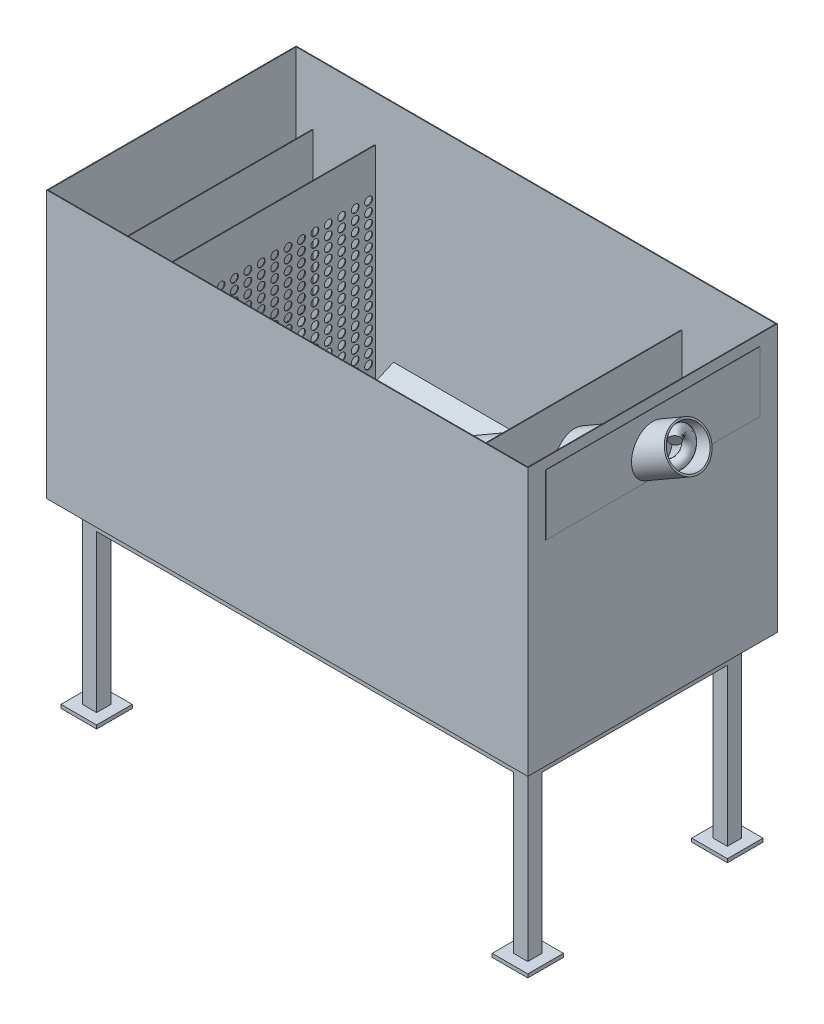
from build123d import *

# Parameters (mm, degrees)
MASTER_FOOTPRINT_W                       = 1350
MASTER_FOOTPRINT_H                       = 700
BATH_BASE_PLATE_DEPTH                    = 750
BATH_SHELL_2MM_T                         = -2
SKETCH_1_R                               = 50.00000000000001
INLET_D100_OPENING_DEPTH                 = 10
INLET_IMPACT_BAFFLE_START                = 125
SKETCH_2_W                               = 540
SKETCH_2_H                               = 430
INLET_IMPACT_BAFFLE_DEPTH                = 2
DISTRIBUTOR_D22_START                    = 250
SKETCH_3_W                               = 639.9999999999999
SKETCH_3_H                               = 648
SKETCH_3_R                               = 11.000000000000004
SKETCH_3_R_2                             = 10.999999999999996
SKETCH_3_R_3                             = 11.00000000000001
DISTRIBUTOR_D22_DEPTH                    = 2
OUTLET_SUBMERGED_BAFFLE_START            = 1130.0000000000002
SKETCH_4_W                               = 599.9999999999999
SKETCH_4_H                               = 330
OUTLET_SUBMERGED_BAFFLE_DEPTH            = 2
OVERFLOW_WEIR_Z550_START                 = 1290
SKETCH_5_W                               = 690
SKETCH_5_H                               = 548
OVERFLOW_WEIR_Z550_DEPTH                 = 2
OUTLET_WEIR_SLOT_W600_START              = 1345.0000000000002
SKETCH_6_W                               = 599.9999999999999
SKETCH_6_H                               = 170
OUTLET_WEIR_SLOT_W600_DEPTH              = 10
SLOPED_SEDIMENT_FLOOR_START              = 275
SLOPED_SEDIMENT_FLOOR_DEPTH              = 825.0000000000001
SKETCH_8_W                               = 39.99999999999999
SKETCH_8_H                               = 39.99999999999999
SKETCH_8_H_2                             = 40
SKETCH_8_W_2                             = 40
FRAME_LEGS_40X40_H500_DEPTH              = 500
FRAME_LONGITUDINAL_RAILS_START           = -20
SKETCH_9_W                               = 1250
SKETCH_9_H                               = 39.99999999999999
SKETCH_9_H_2                             = 39.999999999999886
FRAME_LONGITUDINAL_RAILS_DEPTH           = 40
FRAME_TRANSVERSE_RAILS_START             = -20
SKETCH_10_W                              = 39.99999999999999
SKETCH_10_H                              = 520
SKETCH_10_W_2                            = 40
FRAME_TRANSVERSE_RAILS_DEPTH             = 40
FRAME_FOOT_PADS_100X100_START            = -500
SKETCH_11_W                              = 100.00000000000001
SKETCH_11_H                              = 100.00000000000001
SKETCH_11_H_2                            = 99.99999999999989
SKETCH_11_W_2                            = 100
FRAME_FOOT_PADS_100X100_DEPTH            = 10
SCREW_PASSAGE_D120_PROFILE_R             = 60
SCREW_CASING_ID110_T5_PROFILE_R          = 60
SCREW_CASING_ID110_T5_PROFILE_R_2        = 55
SHAFTLESS_ROUND_COIL_D100_P100_PROFILE_R = 15
CFD_INLET_LID_D100_START                 = 1
SKETCH_12_R                              = 49.999999999999986
CFD_INLET_LID_D100_DEPTH                 = 2
CFD_OUTLET_LID_W600_START                = 1349.0000000000002
SKETCH_13_W                              = 599.9999999999999
SKETCH_13_H                              = 170
CFD_OUTLET_LID_W600_DEPTH                = 2


with BuildPart() as part:
    # MASTER_FOOTPRINT → BATH_BASE_PLATE (new body)
    with BuildSketch(Plane(origin=(0, 0, 0), x_dir=(1, 0, 0), z_dir=(0, 1, 0))):
        with Locations((675, 350)):
            Rectangle(MASTER_FOOTPRINT_W, MASTER_FOOTPRINT_H)
    extrude(amount=BATH_BASE_PLATE_DEPTH)

    # BATH_SHELL_2MM
    bath_shell_2mm_openings = [part.faces().sort_by_distance(p)[0] for p in [
        (675, 750, -350),
    ]]
    offset(amount=BATH_SHELL_2MM_T, openings=bath_shell_2mm_openings, kind=Kind.INTERSECTION)

    # Эскиз1 → INLET_D100_OPENING (cut)
    with BuildSketch(Plane(origin=(0, 0, 0), x_dir=(0, 0, -1), z_dir=(1, 0, 0))):
        with Locations((350, 420)):
            Circle(SKETCH_1_R)
    extrude(amount=INLET_D100_OPENING_DEPTH, mode=Mode.SUBTRACT)

    # Эскиз6 → OUTLET_WEIR_SLOT_W600 (cut)
    with BuildSketch(Plane(origin=(0, 0, 0), x_dir=(0, 0, -1), z_dir=(1, 0, 0)).offset(OUTLET_WEIR_SLOT_W600_START)):
        with Locations((349.99999999999994, 635)):
            Rectangle(SKETCH_6_W, SKETCH_6_H)
    extrude(amount=OUTLET_WEIR_SLOT_W600_DEPTH, mode=Mode.SUBTRACT)

    # Эскиз7 → SLOPED_SEDIMENT_FLOOR (add)
    with BuildSketch(Plane(origin=(0, 0, 0), x_dir=(0, 0, -1), z_dir=(1, 0, 0)).offset(SLOPED_SEDIMENT_FLOOR_START)):
        Polygon((2, -1), (2, 120), (279.99999999999994, -1), align=None)
        Polygon((698, -1), (698, 120), (420, -1), align=None)
    extrude(amount=SLOPED_SEDIMENT_FLOOR_DEPTH)

    # Эскиз8 → FRAME_LEGS_40X40_H500 (add)
    with BuildSketch(Plane(origin=(0, 0, 0), x_dir=(1, 0, 0), z_dir=(0, 1, 0))):
        with Locations((70, 70)):
            Rectangle(SKETCH_8_W, SKETCH_8_H)
        with Locations((70, 630)):
            Rectangle(SKETCH_8_W, SKETCH_8_H_2)
        with Locations((1280, 70)):
            Rectangle(SKETCH_8_W_2, SKETCH_8_H)
        with Locations((1280, 630)):
            Rectangle(SKETCH_8_W_2, SKETCH_8_H_2)
    extrude(amount=-FRAME_LEGS_40X40_H500_DEPTH)

    # Эскиз9 → FRAME_LONGITUDINAL_RAILS (add)
    with BuildSketch(Plane(origin=(0, 0, 0), x_dir=(1, 0, 0), z_dir=(0, 1, 0)).offset(FRAME_LONGITUDINAL_RAILS_START)):
        with Locations((675, 70)):
            Rectangle(SKETCH_9_W, SKETCH_9_H)
        with Locations((675, 630)):
            Rectangle(SKETCH_9_W, SKETCH_9_H_2)
    extrude(amount=-FRAME_LONGITUDINAL_RAILS_DEPTH)

    # Эскиз10 → FRAME_TRANSVERSE_RAILS (add)
    with BuildSketch(Plane(origin=(0, 0, 0), x_dir=(1, 0, 0), z_dir=(0, 1, 0)).offset(FRAME_TRANSVERSE_RAILS_START)):
        with Locations((70, 350)):
            Rectangle(SKETCH_10_W, SKETCH_10_H)
        with Locations((1280, 350)):
            Rectangle(SKETCH_10_W_2, SKETCH_10_H)
    extrude(amount=-FRAME_TRANSVERSE_RAILS_DEPTH)

    # Эскиз11 → FRAME_FOOT_PADS_100X100 (add)
    with BuildSketch(Plane(origin=(0, 0, 0), x_dir=(1, 0, 0), z_dir=(0, 1, 0)).offset(FRAME_FOOT_PADS_100X100_START)):
        with Locations((70, 70)):
            Rectangle(SKETCH_11_W, SKETCH_11_H)
        with Locations((70, 630)):
            Rectangle(SKETCH_11_W, SKETCH_11_H_2)
        with Locations((1280, 70)):
            Rectangle(SKETCH_11_W_2, SKETCH_11_H)
        with Locations((1280, 630)):
            Rectangle(SKETCH_11_W_2, SKETCH_11_H_2)
    extrude(amount=-FRAME_FOOT_PADS_100X100_DEPTH)


with BuildPart() as body_2:
    # Эскиз2 → INLET_IMPACT_BAFFLE (new body)
    with BuildSketch(Plane(origin=(0, 0, 0), x_dir=(0, 0, -1), z_dir=(1, 0, 0)).offset(INLET_IMPACT_BAFFLE_START)):
        with Locations((350, 435)):
            Rectangle(SKETCH_2_W, SKETCH_2_H)
    extrude(amount=INLET_IMPACT_BAFFLE_DEPTH)


with BuildPart() as body_3:
    # Эскиз3 → DISTRIBUTOR_D22 (new body)
    with BuildSketch(Plane(origin=(0, 0, 0), x_dir=(0, 0, -1), z_dir=(1, 0, 0)).offset(DISTRIBUTOR_D22_START)):
        with Locations((349.99999999999994, 326)):
            Rectangle(SKETCH_3_W, SKETCH_3_H)
        with Locations((48.8235294117647, 125)):
            Circle(SKETCH_3_R, mode=Mode.SUBTRACT)
        with Locations((48.8235294117647, 153.5)):
            Circle(SKETCH_3_R, mode=Mode.SUBTRACT)
        with Locations((48.8235294117647, 182)):
            Circle(SKETCH_3_R, mode=Mode.SUBTRACT)
        with Locations((48.8235294117647, 210.50000000000003)):
            Circle(SKETCH_3_R, mode=Mode.SUBTRACT)
        with Locations((48.8235294117647, 239)):
            Circle(SKETCH_3_R, mode=Mode.SUBTRACT)
        with Locations((48.8235294117647, 267.5)):
            Circle(SKETCH_3_R, mode=Mode.SUBTRACT)
        with Locations((48.8235294117647, 296.00000000000006)):
            Circle(SKETCH_3_R, mode=Mode.SUBTRACT)
        with Locations((48.8235294117647, 324.5)):
            Circle(SKETCH_3_R, mode=Mode.SUBTRACT)
        with Locations((48.8235294117647, 353)):
            Circle(SKETCH_3_R, mode=Mode.SUBTRACT)
        with Locations((48.8235294117647, 381.5)):
            Circle(SKETCH_3_R, mode=Mode.SUBTRACT)
        with Locations((48.8235294117647, 410.00000000000006)):
            Circle(SKETCH_3_R, mode=Mode.SUBTRACT)
        with Locations((48.8235294117647, 438.5)):
            Circle(SKETCH_3_R, mode=Mode.SUBTRACT)
        with Locations((48.8235294117647, 467)):
            Circle(SKETCH_3_R, mode=Mode.SUBTRACT)
        with Locations((48.8235294117647, 495.5)):
            Circle(SKETCH_3_R, mode=Mode.SUBTRACT)
        with Locations((48.8235294117647, 524)):
            Circle(SKETCH_3_R, mode=Mode.SUBTRACT)
        with Locations((86.4705882352941, 125)):
            Circle(SKETCH_3_R_2, mode=Mode.SUBTRACT)
        with Locations((86.4705882352941, 153.5)):
            Circle(SKETCH_3_R_2, mode=Mode.SUBTRACT)
        with Locations((86.4705882352941, 182)):
            Circle(SKETCH_3_R_2, mode=Mode.SUBTRACT)
        with Locations((86.4705882352941, 210.50000000000003)):
            Circle(SKETCH_3_R_2, mode=Mode.SUBTRACT)
        with Locations((86.4705882352941, 239)):
            Circle(SKETCH_3_R_2, mode=Mode.SUBTRACT)
        with Locations((86.4705882352941, 267.5)):
            Circle(SKETCH_3_R_2, mode=Mode.SUBTRACT)
        with Locations((86.4705882352941, 296.00000000000006)):
            Circle(SKETCH_3_R_2, mode=Mode.SUBTRACT)
        with Locations((86.4705882352941, 324.5)):
            Circle(SKETCH_3_R_2, mode=Mode.SUBTRACT)
        with Locations((86.4705882352941, 353)):
            Circle(SKETCH_3_R_2, mode=Mode.SUBTRACT)
        with Locations((86.4705882352941, 381.5)):
            Circle(SKETCH_3_R_2, mode=Mode.SUBTRACT)
        with Locations((86.4705882352941, 410.00000000000006)):
            Circle(SKETCH_3_R_2, mode=Mode.SUBTRACT)
        with Locations((86.4705882352941, 438.5)):
            Circle(SKETCH_3_R_2, mode=Mode.SUBTRACT)
        with Locations((86.4705882352941, 467)):
            Circle(SKETCH_3_R_2, mode=Mode.SUBTRACT)
        with Locations((86.4705882352941, 495.5)):
            Circle(SKETCH_3_R_2, mode=Mode.SUBTRACT)
        with Locations((86.4705882352941, 524)):
            Circle(SKETCH_3_R_2, mode=Mode.SUBTRACT)
        with Locations((124.11764705882351, 125)):
            Circle(SKETCH_3_R_2, mode=Mode.SUBTRACT)
        with Locations((124.11764705882351, 153.5)):
            Circle(SKETCH_3_R_2, mode=Mode.SUBTRACT)
        with Locations((124.11764705882351, 182)):
            Circle(SKETCH_3_R_2, mode=Mode.SUBTRACT)
        with Locations((124.11764705882351, 210.50000000000003)):
            Circle(SKETCH_3_R_2, mode=Mode.SUBTRACT)
        with Locations((124.11764705882351, 239)):
            Circle(SKETCH_3_R_2, mode=Mode.SUBTRACT)
        with Locations((124.11764705882351, 267.5)):
            Circle(SKETCH_3_R_2, mode=Mode.SUBTRACT)
        with Locations((124.11764705882351, 296.00000000000006)):
            Circle(SKETCH_3_R_2, mode=Mode.SUBTRACT)
        with Locations((124.11764705882351, 324.5)):
            Circle(SKETCH_3_R_2, mode=Mode.SUBTRACT)
        with Locations((124.11764705882351, 353)):
            Circle(SKETCH_3_R_2, mode=Mode.SUBTRACT)
        with Locations((124.11764705882351, 381.5)):
            Circle(SKETCH_3_R_2, mode=Mode.SUBTRACT)
        with Locations((124.11764705882351, 410.00000000000006)):
            Circle(SKETCH_3_R_2, mode=Mode.SUBTRACT)
        with Locations((124.11764705882351, 438.5)):
            Circle(SKETCH_3_R_2, mode=Mode.SUBTRACT)
        with Locations((124.11764705882351, 467)):
            Circle(SKETCH_3_R_2, mode=Mode.SUBTRACT)
        with Locations((124.11764705882351, 495.5)):
            Circle(SKETCH_3_R_2, mode=Mode.SUBTRACT)
        with Locations((124.11764705882351, 524)):
            Circle(SKETCH_3_R_2, mode=Mode.SUBTRACT)
        with Locations((161.76470588235293, 125)):
            Circle(SKETCH_3_R_3, mode=Mode.SUBTRACT)
        with Locations((161.76470588235293, 153.5)):
            Circle(SKETCH_3_R_3, mode=Mode.SUBTRACT)
        with Locations((161.76470588235293, 182)):
            Circle(SKETCH_3_R_3, mode=Mode.SUBTRACT)
        with Locations((161.76470588235293, 210.50000000000003)):
            Circle(SKETCH_3_R_3, mode=Mode.SUBTRACT)
        with Locations((161.76470588235293, 239)):
            Circle(SKETCH_3_R_3, mode=Mode.SUBTRACT)
        with Locations((161.76470588235293, 267.5)):
            Circle(SKETCH_3_R_3, mode=Mode.SUBTRACT)
        with Locations((161.76470588235293, 296.00000000000006)):
            Circle(SKETCH_3_R_3, mode=Mode.SUBTRACT)
        with Locations((161.76470588235293, 324.5)):
            Circle(SKETCH_3_R_3, mode=Mode.SUBTRACT)
        with Locations((161.76470588235293, 353)):
            Circle(SKETCH_3_R_3, mode=Mode.SUBTRACT)
        with Locations((161.76470588235293, 381.5)):
            Circle(SKETCH_3_R_3, mode=Mode.SUBTRACT)
        with Locations((161.76470588235293, 410.00000000000006)):
            Circle(SKETCH_3_R_3, mode=Mode.SUBTRACT)
        with Locations((161.76470588235293, 438.5)):
            Circle(SKETCH_3_R_3, mode=Mode.SUBTRACT)
        with Locations((161.76470588235293, 467)):
            Circle(SKETCH_3_R_3, mode=Mode.SUBTRACT)
        with Locations((161.76470588235293, 495.5)):
            Circle(SKETCH_3_R_3, mode=Mode.SUBTRACT)
        with Locations((161.76470588235293, 524)):
            Circle(SKETCH_3_R_3, mode=Mode.SUBTRACT)
        with Locations((199.41176470588232, 125)):
            Circle(SKETCH_3_R_3, mode=Mode.SUBTRACT)
        with Locations((199.41176470588232, 153.5)):
            Circle(SKETCH_3_R_3, mode=Mode.SUBTRACT)
        with Locations((199.41176470588232, 182)):
            Circle(SKETCH_3_R_3, mode=Mode.SUBTRACT)
        with Locations((199.41176470588232, 210.50000000000003)):
            Circle(SKETCH_3_R_3, mode=Mode.SUBTRACT)
        with Locations((199.41176470588232, 239)):
            Circle(SKETCH_3_R_3, mode=Mode.SUBTRACT)
        with Locations((199.41176470588232, 267.5)):
            Circle(SKETCH_3_R_3, mode=Mode.SUBTRACT)
        with Locations((199.41176470588232, 296.00000000000006)):
            Circle(SKETCH_3_R_3, mode=Mode.SUBTRACT)
        with Locations((199.41176470588232, 324.5)):
            Circle(SKETCH_3_R_3, mode=Mode.SUBTRACT)
        with Locations((199.41176470588232, 353)):
            Circle(SKETCH_3_R_3, mode=Mode.SUBTRACT)
        with Locations((199.41176470588232, 381.5)):
            Circle(SKETCH_3_R_3, mode=Mode.SUBTRACT)
        with Locations((199.41176470588232, 410.00000000000006)):
            Circle(SKETCH_3_R_3, mode=Mode.SUBTRACT)
        with Locations((199.41176470588232, 438.5)):
            Circle(SKETCH_3_R_3, mode=Mode.SUBTRACT)
        with Locations((199.41176470588232, 467)):
            Circle(SKETCH_3_R_3, mode=Mode.SUBTRACT)
        with Locations((199.41176470588232, 495.5)):
            Circle(SKETCH_3_R_3, mode=Mode.SUBTRACT)
        with Locations((199.41176470588232, 524)):
            Circle(SKETCH_3_R_3, mode=Mode.SUBTRACT)
        with Locations((237.05882352941174, 125)):
            Circle(SKETCH_3_R_3, mode=Mode.SUBTRACT)
        with Locations((237.05882352941174, 153.5)):
            Circle(SKETCH_3_R_3, mode=Mode.SUBTRACT)
        with Locations((237.05882352941174, 182)):
            Circle(SKETCH_3_R_3, mode=Mode.SUBTRACT)
        with Locations((237.05882352941174, 210.50000000000003)):
            Circle(SKETCH_3_R_3, mode=Mode.SUBTRACT)
        with Locations((237.05882352941174, 239)):
            Circle(SKETCH_3_R_3, mode=Mode.SUBTRACT)
        with Locations((237.05882352941174, 267.5)):
            Circle(SKETCH_3_R_3, mode=Mode.SUBTRACT)
        with Locations((237.05882352941174, 296.00000000000006)):
            Circle(SKETCH_3_R_3, mode=Mode.SUBTRACT)
        with Locations((237.05882352941174, 324.5)):
            Circle(SKETCH_3_R_3, mode=Mode.SUBTRACT)
        with Locations((237.05882352941174, 353)):
            Circle(SKETCH_3_R_3, mode=Mode.SUBTRACT)
        with Locations((237.05882352941174, 381.5)):
            Circle(SKETCH_3_R_3, mode=Mode.SUBTRACT)
        with Locations((237.05882352941174, 410.00000000000006)):
            Circle(SKETCH_3_R_3, mode=Mode.SUBTRACT)
        with Locations((237.05882352941174, 438.5)):
            Circle(SKETCH_3_R_3, mode=Mode.SUBTRACT)
        with Locations((237.05882352941174, 467)):
            Circle(SKETCH_3_R_3, mode=Mode.SUBTRACT)
        with Locations((237.05882352941174, 495.5)):
            Circle(SKETCH_3_R_3, mode=Mode.SUBTRACT)
        with Locations((237.05882352941174, 524)):
            Circle(SKETCH_3_R_3, mode=Mode.SUBTRACT)
        with Locations((274.70588235294116, 125)):
            Circle(SKETCH_3_R_3, mode=Mode.SUBTRACT)
        with Locations((274.70588235294116, 153.5)):
            Circle(SKETCH_3_R_3, mode=Mode.SUBTRACT)
        with Locations((274.70588235294116, 182)):
            Circle(SKETCH_3_R_3, mode=Mode.SUBTRACT)
        with Locations((274.70588235294116, 210.50000000000003)):
            Circle(SKETCH_3_R_3, mode=Mode.SUBTRACT)
        with Locations((274.70588235294116, 239)):
            Circle(SKETCH_3_R_3, mode=Mode.SUBTRACT)
        with Locations((274.70588235294116, 267.5)):
            Circle(SKETCH_3_R_3, mode=Mode.SUBTRACT)
        with Locations((274.70588235294116, 296.00000000000006)):
            Circle(SKETCH_3_R_3, mode=Mode.SUBTRACT)
        with Locations((274.70588235294116, 324.5)):
            Circle(SKETCH_3_R_3, mode=Mode.SUBTRACT)
        with Locations((274.70588235294116, 353)):
            Circle(SKETCH_3_R_3, mode=Mode.SUBTRACT)
        with Locations((274.70588235294116, 381.5)):
            Circle(SKETCH_3_R_3, mode=Mode.SUBTRACT)
        with Locations((274.70588235294116, 410.00000000000006)):
            Circle(SKETCH_3_R_3, mode=Mode.SUBTRACT)
        with Locations((274.70588235294116, 438.5)):
            Circle(SKETCH_3_R_3, mode=Mode.SUBTRACT)
        with Locations((274.70588235294116, 467)):
            Circle(SKETCH_3_R_3, mode=Mode.SUBTRACT)
        with Locations((274.70588235294116, 495.5)):
            Circle(SKETCH_3_R_3, mode=Mode.SUBTRACT)
        with Locations((274.70588235294116, 524)):
            Circle(SKETCH_3_R_3, mode=Mode.SUBTRACT)
        with Locations((312.3529411764705, 125)):
            Circle(SKETCH_3_R_3, mode=Mode.SUBTRACT)
        with Locations((312.3529411764705, 153.5)):
            Circle(SKETCH_3_R_3, mode=Mode.SUBTRACT)
        with Locations((312.3529411764705, 182)):
            Circle(SKETCH_3_R_3, mode=Mode.SUBTRACT)
        with Locations((312.3529411764705, 210.50000000000003)):
            Circle(SKETCH_3_R_3, mode=Mode.SUBTRACT)
        with Locations((312.3529411764705, 239)):
            Circle(SKETCH_3_R_3, mode=Mode.SUBTRACT)
        with Locations((312.3529411764705, 267.5)):
            Circle(SKETCH_3_R_3, mode=Mode.SUBTRACT)
        with Locations((312.3529411764705, 296.00000000000006)):
            Circle(SKETCH_3_R_3, mode=Mode.SUBTRACT)
        with Locations((312.3529411764705, 324.5)):
            Circle(SKETCH_3_R_3, mode=Mode.SUBTRACT)
        with Locations((312.3529411764705, 353)):
            Circle(SKETCH_3_R_3, mode=Mode.SUBTRACT)
        with Locations((312.3529411764705, 381.5)):
            Circle(SKETCH_3_R_3, mode=Mode.SUBTRACT)
        with Locations((312.3529411764705, 410.00000000000006)):
            Circle(SKETCH_3_R_3, mode=Mode.SUBTRACT)
        with Locations((312.3529411764705, 438.5)):
            Circle(SKETCH_3_R_3, mode=Mode.SUBTRACT)
        with Locations((312.3529411764705, 467)):
            Circle(SKETCH_3_R_3, mode=Mode.SUBTRACT)
        with Locations((312.3529411764705, 495.5)):
            Circle(SKETCH_3_R_3, mode=Mode.SUBTRACT)
        with Locations((312.3529411764705, 524)):
            Circle(SKETCH_3_R_3, mode=Mode.SUBTRACT)
        with Locations((350, 125)):
            Circle(SKETCH_3_R_3, mode=Mode.SUBTRACT)
        with Locations((350, 153.5)):
            Circle(SKETCH_3_R_3, mode=Mode.SUBTRACT)
        with Locations((350, 182)):
            Circle(SKETCH_3_R_3, mode=Mode.SUBTRACT)
        with Locations((350, 210.50000000000003)):
            Circle(SKETCH_3_R_3, mode=Mode.SUBTRACT)
        with Locations((350, 239)):
            Circle(SKETCH_3_R_3, mode=Mode.SUBTRACT)
        with Locations((350, 267.5)):
            Circle(SKETCH_3_R_3, mode=Mode.SUBTRACT)
        with Locations((350, 296.00000000000006)):
            Circle(SKETCH_3_R_3, mode=Mode.SUBTRACT)
        with Locations((350, 324.5)):
            Circle(SKETCH_3_R_3, mode=Mode.SUBTRACT)
        with Locations((350, 353)):
            Circle(SKETCH_3_R_3, mode=Mode.SUBTRACT)
        with Locations((350, 381.5)):
            Circle(SKETCH_3_R_3, mode=Mode.SUBTRACT)
        with Locations((350, 410.00000000000006)):
            Circle(SKETCH_3_R_3, mode=Mode.SUBTRACT)
        with Locations((350, 438.5)):
            Circle(SKETCH_3_R_3, mode=Mode.SUBTRACT)
        with Locations((350, 467)):
            Circle(SKETCH_3_R_3, mode=Mode.SUBTRACT)
        with Locations((350, 495.5)):
            Circle(SKETCH_3_R_3, mode=Mode.SUBTRACT)
        with Locations((350, 524)):
            Circle(SKETCH_3_R_3, mode=Mode.SUBTRACT)
        with Locations((387.64705882352933, 125)):
            Circle(SKETCH_3_R_3, mode=Mode.SUBTRACT)
        with Locations((387.64705882352933, 153.5)):
            Circle(SKETCH_3_R_3, mode=Mode.SUBTRACT)
        with Locations((387.64705882352933, 182)):
            Circle(SKETCH_3_R_3, mode=Mode.SUBTRACT)
        with Locations((387.64705882352933, 210.50000000000003)):
            Circle(SKETCH_3_R_3, mode=Mode.SUBTRACT)
        with Locations((387.64705882352933, 239)):
            Circle(SKETCH_3_R_3, mode=Mode.SUBTRACT)
        with Locations((387.64705882352933, 267.5)):
            Circle(SKETCH_3_R_3, mode=Mode.SUBTRACT)
        with Locations((387.64705882352933, 296.00000000000006)):
            Circle(SKETCH_3_R_3, mode=Mode.SUBTRACT)
        with Locations((387.64705882352933, 324.5)):
            Circle(SKETCH_3_R_3, mode=Mode.SUBTRACT)
        with Locations((387.64705882352933, 353)):
            Circle(SKETCH_3_R_3, mode=Mode.SUBTRACT)
        with Locations((387.64705882352933, 381.5)):
            Circle(SKETCH_3_R_3, mode=Mode.SUBTRACT)
        with Locations((387.64705882352933, 410.00000000000006)):
            Circle(SKETCH_3_R_3, mode=Mode.SUBTRACT)
        with Locations((387.64705882352933, 438.5)):
            Circle(SKETCH_3_R_3, mode=Mode.SUBTRACT)
        with Locations((387.64705882352933, 467)):
            Circle(SKETCH_3_R_3, mode=Mode.SUBTRACT)
        with Locations((387.64705882352933, 495.5)):
            Circle(SKETCH_3_R_3, mode=Mode.SUBTRACT)
        with Locations((387.64705882352933, 524)):
            Circle(SKETCH_3_R_3, mode=Mode.SUBTRACT)
        with Locations((425.2941176470587, 125)):
            Circle(SKETCH_3_R_3, mode=Mode.SUBTRACT)
        with Locations((425.2941176470587, 153.5)):
            Circle(SKETCH_3_R_3, mode=Mode.SUBTRACT)
        with Locations((425.2941176470587, 182)):
            Circle(SKETCH_3_R_3, mode=Mode.SUBTRACT)
        with Locations((425.2941176470587, 210.50000000000003)):
            Circle(SKETCH_3_R_3, mode=Mode.SUBTRACT)
        with Locations((425.2941176470587, 239)):
            Circle(SKETCH_3_R_3, mode=Mode.SUBTRACT)
        with Locations((425.2941176470587, 267.5)):
            Circle(SKETCH_3_R_3, mode=Mode.SUBTRACT)
        with Locations((425.2941176470587, 296.00000000000006)):
            Circle(SKETCH_3_R_3, mode=Mode.SUBTRACT)
        with Locations((425.2941176470587, 324.5)):
            Circle(SKETCH_3_R_3, mode=Mode.SUBTRACT)
        with Locations((425.2941176470587, 353)):
            Circle(SKETCH_3_R_3, mode=Mode.SUBTRACT)
        with Locations((425.2941176470587, 381.5)):
            Circle(SKETCH_3_R_3, mode=Mode.SUBTRACT)
        with Locations((425.2941176470587, 410.00000000000006)):
            Circle(SKETCH_3_R_3, mode=Mode.SUBTRACT)
        with Locations((425.2941176470587, 438.5)):
            Circle(SKETCH_3_R_3, mode=Mode.SUBTRACT)
        with Locations((425.2941176470587, 467)):
            Circle(SKETCH_3_R_3, mode=Mode.SUBTRACT)
        with Locations((425.2941176470587, 495.5)):
            Circle(SKETCH_3_R_3, mode=Mode.SUBTRACT)
        with Locations((425.2941176470587, 524)):
            Circle(SKETCH_3_R_3, mode=Mode.SUBTRACT)
        with Locations((462.9411764705882, 125)):
            Circle(SKETCH_3_R_3, mode=Mode.SUBTRACT)
        with Locations((462.9411764705882, 153.5)):
            Circle(SKETCH_3_R_3, mode=Mode.SUBTRACT)
        with Locations((462.9411764705882, 182)):
            Circle(SKETCH_3_R_3, mode=Mode.SUBTRACT)
        with Locations((462.9411764705882, 210.50000000000003)):
            Circle(SKETCH_3_R_3, mode=Mode.SUBTRACT)
        with Locations((462.9411764705882, 239)):
            Circle(SKETCH_3_R_3, mode=Mode.SUBTRACT)
        with Locations((462.9411764705882, 267.5)):
            Circle(SKETCH_3_R_3, mode=Mode.SUBTRACT)
        with Locations((462.9411764705882, 296.00000000000006)):
            Circle(SKETCH_3_R_3, mode=Mode.SUBTRACT)
        with Locations((462.9411764705882, 324.5)):
            Circle(SKETCH_3_R_3, mode=Mode.SUBTRACT)
        with Locations((462.9411764705882, 353)):
            Circle(SKETCH_3_R_3, mode=Mode.SUBTRACT)
        with Locations((462.9411764705882, 381.5)):
            Circle(SKETCH_3_R_3, mode=Mode.SUBTRACT)
        with Locations((462.9411764705882, 410.00000000000006)):
            Circle(SKETCH_3_R_3, mode=Mode.SUBTRACT)
        with Locations((462.9411764705882, 438.5)):
            Circle(SKETCH_3_R_3, mode=Mode.SUBTRACT)
        with Locations((462.9411764705882, 467)):
            Circle(SKETCH_3_R_3, mode=Mode.SUBTRACT)
        with Locations((462.9411764705882, 495.5)):
            Circle(SKETCH_3_R_3, mode=Mode.SUBTRACT)
        with Locations((462.9411764705882, 524)):
            Circle(SKETCH_3_R_3, mode=Mode.SUBTRACT)
        with Locations((500.58823529411757, 125)):
            Circle(SKETCH_3_R_3, mode=Mode.SUBTRACT)
        with Locations((500.58823529411757, 153.5)):
            Circle(SKETCH_3_R_3, mode=Mode.SUBTRACT)
        with Locations((500.58823529411757, 182)):
            Circle(SKETCH_3_R_3, mode=Mode.SUBTRACT)
        with Locations((500.58823529411757, 210.50000000000003)):
            Circle(SKETCH_3_R_3, mode=Mode.SUBTRACT)
        with Locations((500.58823529411757, 239)):
            Circle(SKETCH_3_R_3, mode=Mode.SUBTRACT)
        with Locations((500.58823529411757, 267.5)):
            Circle(SKETCH_3_R_3, mode=Mode.SUBTRACT)
        with Locations((500.58823529411757, 296.00000000000006)):
            Circle(SKETCH_3_R_3, mode=Mode.SUBTRACT)
        with Locations((500.58823529411757, 324.5)):
            Circle(SKETCH_3_R_3, mode=Mode.SUBTRACT)
        with Locations((500.58823529411757, 353)):
            Circle(SKETCH_3_R_3, mode=Mode.SUBTRACT)
        with Locations((500.58823529411757, 381.5)):
            Circle(SKETCH_3_R_3, mode=Mode.SUBTRACT)
        with Locations((500.58823529411757, 410.00000000000006)):
            Circle(SKETCH_3_R_3, mode=Mode.SUBTRACT)
        with Locations((500.58823529411757, 438.5)):
            Circle(SKETCH_3_R_3, mode=Mode.SUBTRACT)
        with Locations((500.58823529411757, 467)):
            Circle(SKETCH_3_R_3, mode=Mode.SUBTRACT)
        with Locations((500.58823529411757, 495.5)):
            Circle(SKETCH_3_R_3, mode=Mode.SUBTRACT)
        with Locations((500.58823529411757, 524)):
            Circle(SKETCH_3_R_3, mode=Mode.SUBTRACT)
        with Locations((538.2352941176471, 125)):
            Circle(SKETCH_3_R_3, mode=Mode.SUBTRACT)
        with Locations((538.2352941176471, 153.5)):
            Circle(SKETCH_3_R_3, mode=Mode.SUBTRACT)
        with Locations((538.2352941176471, 182)):
            Circle(SKETCH_3_R_3, mode=Mode.SUBTRACT)
        with Locations((538.2352941176471, 210.50000000000003)):
            Circle(SKETCH_3_R_3, mode=Mode.SUBTRACT)
        with Locations((538.2352941176471, 239)):
            Circle(SKETCH_3_R_3, mode=Mode.SUBTRACT)
        with Locations((538.2352941176471, 267.5)):
            Circle(SKETCH_3_R_3, mode=Mode.SUBTRACT)
        with Locations((538.2352941176471, 296.00000000000006)):
            Circle(SKETCH_3_R_3, mode=Mode.SUBTRACT)
        with Locations((538.2352941176471, 324.5)):
            Circle(SKETCH_3_R_3, mode=Mode.SUBTRACT)
        with Locations((538.2352941176471, 353)):
            Circle(SKETCH_3_R_3, mode=Mode.SUBTRACT)
        with Locations((538.2352941176471, 381.5)):
            Circle(SKETCH_3_R_3, mode=Mode.SUBTRACT)
        with Locations((538.2352941176471, 410.00000000000006)):
            Circle(SKETCH_3_R_3, mode=Mode.SUBTRACT)
        with Locations((538.2352941176471, 438.5)):
            Circle(SKETCH_3_R_3, mode=Mode.SUBTRACT)
        with Locations((538.2352941176471, 467)):
            Circle(SKETCH_3_R_3, mode=Mode.SUBTRACT)
        with Locations((538.2352941176471, 495.5)):
            Circle(SKETCH_3_R_3, mode=Mode.SUBTRACT)
        with Locations((538.2352941176471, 524)):
            Circle(SKETCH_3_R_3, mode=Mode.SUBTRACT)
        with Locations((575.8823529411765, 125)):
            Circle(SKETCH_3_R_3, mode=Mode.SUBTRACT)
        with Locations((575.8823529411765, 153.5)):
            Circle(SKETCH_3_R_3, mode=Mode.SUBTRACT)
        with Locations((575.8823529411765, 182)):
            Circle(SKETCH_3_R_3, mode=Mode.SUBTRACT)
        with Locations((575.8823529411765, 210.50000000000003)):
            Circle(SKETCH_3_R_3, mode=Mode.SUBTRACT)
        with Locations((575.8823529411765, 239)):
            Circle(SKETCH_3_R_3, mode=Mode.SUBTRACT)
        with Locations((575.8823529411765, 267.5)):
            Circle(SKETCH_3_R_3, mode=Mode.SUBTRACT)
        with Locations((575.8823529411765, 296.00000000000006)):
            Circle(SKETCH_3_R_3, mode=Mode.SUBTRACT)
        with Locations((575.8823529411765, 324.5)):
            Circle(SKETCH_3_R_3, mode=Mode.SUBTRACT)
        with Locations((575.8823529411765, 353)):
            Circle(SKETCH_3_R_3, mode=Mode.SUBTRACT)
        with Locations((575.8823529411765, 381.5)):
            Circle(SKETCH_3_R_3, mode=Mode.SUBTRACT)
        with Locations((575.8823529411765, 410.00000000000006)):
            Circle(SKETCH_3_R_3, mode=Mode.SUBTRACT)
        with Locations((575.8823529411765, 438.5)):
            Circle(SKETCH_3_R_3, mode=Mode.SUBTRACT)
        with Locations((575.8823529411765, 467)):
            Circle(SKETCH_3_R_3, mode=Mode.SUBTRACT)
        with Locations((575.8823529411765, 495.5)):
            Circle(SKETCH_3_R_3, mode=Mode.SUBTRACT)
        with Locations((575.8823529411765, 524)):
            Circle(SKETCH_3_R_3, mode=Mode.SUBTRACT)
        with Locations((613.5294117647057, 125)):
            Circle(SKETCH_3_R_3, mode=Mode.SUBTRACT)
        with Locations((613.5294117647057, 153.5)):
            Circle(SKETCH_3_R_3, mode=Mode.SUBTRACT)
        with Locations((613.5294117647057, 182)):
            Circle(SKETCH_3_R_3, mode=Mode.SUBTRACT)
        with Locations((613.5294117647057, 210.50000000000003)):
            Circle(SKETCH_3_R_3, mode=Mode.SUBTRACT)
        with Locations((613.5294117647057, 239)):
            Circle(SKETCH_3_R_3, mode=Mode.SUBTRACT)
        with Locations((613.5294117647057, 267.5)):
            Circle(SKETCH_3_R_3, mode=Mode.SUBTRACT)
        with Locations((613.5294117647057, 296.00000000000006)):
            Circle(SKETCH_3_R_3, mode=Mode.SUBTRACT)
        with Locations((613.5294117647057, 324.5)):
            Circle(SKETCH_3_R_3, mode=Mode.SUBTRACT)
        with Locations((613.5294117647057, 353)):
            Circle(SKETCH_3_R_3, mode=Mode.SUBTRACT)
        with Locations((613.5294117647057, 381.5)):
            Circle(SKETCH_3_R_3, mode=Mode.SUBTRACT)
        with Locations((613.5294117647057, 410.00000000000006)):
            Circle(SKETCH_3_R_3, mode=Mode.SUBTRACT)
        with Locations((613.5294117647057, 438.5)):
            Circle(SKETCH_3_R_3, mode=Mode.SUBTRACT)
        with Locations((613.5294117647057, 467)):
            Circle(SKETCH_3_R_3, mode=Mode.SUBTRACT)
        with Locations((613.5294117647057, 495.5)):
            Circle(SKETCH_3_R_3, mode=Mode.SUBTRACT)
        with Locations((613.5294117647057, 524)):
            Circle(SKETCH_3_R_3, mode=Mode.SUBTRACT)
        with Locations((651.1764705882352, 125)):
            Circle(SKETCH_3_R_3, mode=Mode.SUBTRACT)
        with Locations((651.1764705882352, 153.5)):
            Circle(SKETCH_3_R_3, mode=Mode.SUBTRACT)
        with Locations((651.1764705882352, 182)):
            Circle(SKETCH_3_R_3, mode=Mode.SUBTRACT)
        with Locations((651.1764705882352, 210.50000000000003)):
            Circle(SKETCH_3_R_3, mode=Mode.SUBTRACT)
        with Locations((651.1764705882352, 239)):
            Circle(SKETCH_3_R_3, mode=Mode.SUBTRACT)
        with Locations((651.1764705882352, 267.5)):
            Circle(SKETCH_3_R_3, mode=Mode.SUBTRACT)
        with Locations((651.1764705882352, 296.00000000000006)):
            Circle(SKETCH_3_R_3, mode=Mode.SUBTRACT)
        with Locations((651.1764705882352, 324.5)):
            Circle(SKETCH_3_R_3, mode=Mode.SUBTRACT)
        with Locations((651.1764705882352, 353)):
            Circle(SKETCH_3_R_3, mode=Mode.SUBTRACT)
        with Locations((651.1764705882352, 381.5)):
            Circle(SKETCH_3_R_3, mode=Mode.SUBTRACT)
        with Locations((651.1764705882352, 410.00000000000006)):
            Circle(SKETCH_3_R_3, mode=Mode.SUBTRACT)
        with Locations((651.1764705882352, 438.5)):
            Circle(SKETCH_3_R_3, mode=Mode.SUBTRACT)
        with Locations((651.1764705882352, 467)):
            Circle(SKETCH_3_R_3, mode=Mode.SUBTRACT)
        with Locations((651.1764705882352, 495.5)):
            Circle(SKETCH_3_R_3, mode=Mode.SUBTRACT)
        with Locations((651.1764705882352, 524)):
            Circle(SKETCH_3_R_3, mode=Mode.SUBTRACT)
    extrude(amount=DISTRIBUTOR_D22_DEPTH)


with BuildPart() as body_4:
    # Эскиз4 → OUTLET_SUBMERGED_BAFFLE (new body)
    with BuildSketch(Plane(origin=(0, 0, 0), x_dir=(0, 0, -1), z_dir=(1, 0, 0)).offset(OUTLET_SUBMERGED_BAFFLE_START)):
        with Locations((349.99999999999994, 485)):
            Rectangle(SKETCH_4_W, SKETCH_4_H)
    extrude(amount=OUTLET_SUBMERGED_BAFFLE_DEPTH)


with BuildPart() as body_5:
    # Эскиз5 → OVERFLOW_WEIR_Z550 (new body)
    with BuildSketch(Plane(origin=(0, 0, 0), x_dir=(0, 0, -1), z_dir=(1, 0, 0)).offset(OVERFLOW_WEIR_Z550_START)):
        with Locations((350, 276)):
            Rectangle(SKETCH_5_W, SKETCH_5_H)
    extrude(amount=OVERFLOW_WEIR_Z550_DEPTH)


with BuildPart() as screw_passage_d120_tool:
    # SCREW_PASSAGE_D120: sweep along a curve in space
    with BuildLine() as screw_passage_d120_path:
        Line((400, 70, -350), (1450.0000000000002, 676.2177826491071, -350))
    # SCREW_PASSAGE_D120 profile (on start of the path) → SCREW_PASSAGE_D120 (sweep)
    with BuildSketch(Plane(origin=(400, 70, -350), x_dir=(-0.5, 0.8660254037844387, 0), z_dir=(0.8660254037844387, 0.5, 0))):
        Circle(SCREW_PASSAGE_D120_PROFILE_R)
    sweep(path=screw_passage_d120_path.line)


with BuildPart() as part_1:
    add(part.part)

    # SCREW_PASSAGE_D120: cut by screw_passage_d120_tool
    add(screw_passage_d120_tool.part, mode=Mode.SUBTRACT)


with BuildPart() as body_4_1:
    add(body_4.part)

    # SCREW_PASSAGE_D120: cut by screw_passage_d120_tool
    add(screw_passage_d120_tool.part, mode=Mode.SUBTRACT)


with BuildPart() as body_5_1:
    add(body_5.part)

    # SCREW_PASSAGE_D120: cut by screw_passage_d120_tool
    add(screw_passage_d120_tool.part, mode=Mode.SUBTRACT)


with BuildPart() as body_6:
    # SCREW_CASING_ID110_T5: sweep along a curve in space
    with BuildLine() as screw_casing_id110_t5_path:
        Line((400, 70, -350), (1450.0000000000002, 676.2177826491071, -350))
    # SCREW_CASING_ID110_T5 profile (on start of the path) → SCREW_CASING_ID110_T5 (sweep)
    with BuildSketch(Plane(origin=(400, 70, -350), x_dir=(-0.5, 0.8660254037844387, 0), z_dir=(0.8660254037844387, 0.5, 0))):
        Circle(SCREW_CASING_ID110_T5_PROFILE_R)
        Circle(SCREW_CASING_ID110_T5_PROFILE_R_2, mode=Mode.SUBTRACT)
    sweep(path=screw_casing_id110_t5_path.line)


with BuildPart() as body_7:
    # SHAFTLESS_ROUND_COIL_D100_P100: sweep along a curve in space
    with BuildLine() as shaftless_round_coil_d100_p100_path:
        add(Edge.make_bspline(
            [(382.5, 100.31088913245537, -350), (384.567133941715, 100.8969533609294, -345.41937053476397), (388.701401825145, 102.06908181787745, -336.25811160429197), (398.1604300649253, 98.18490004107339, -324.60808166218715), (409.3560207013292, 91.29290396280325, -316.8233355514321), (421.65033393475863, 82.4978645230609, -314.08890596127725), (433.9307858703661, 73.72683355540538, -316.8210413351117), (445.1692946376928, 66.76050109381076, -324.60384246654075), (454.4743112597251, 63.143075263901785, -336.25257274072055), (461.25452800851986, 63.89873109338379, -349.9940046218062), (465.3013896758794, 69.38869679903786, -363.73634914911577), (466.82285064220457, 79.25278482835391, -375.38767843443037), (466.41118051505055, 92.4651541292667, -383.1743693075307), (464.9529502042635, 107.49021884141047, -385.9110930377908), (463.49403503443136, 122.51646976421685, -383.18125195642824), (463.080416772081, 135.7322133342697, -375.40039602125114), (464.59895631397717, 145.6013614191271, -363.75296573967546), (468.64239206366375, 151.09726098825328, -350.01199075622054), (475.4191101505716, 151.85897667788203, -336.26919048034273), (484.72142291256205, 148.24623407094234, -324.6165621765701), (495.9571841283184, 141.28466050826435, -316.82792675815875), (508.2399284578545, 132.5096589978527, -314.08890896407274), (520.5238135951332, 123.73268155046961, -316.81645567687616), (531.7628235747587, 116.76548096370868, -324.59536619892936), (541.0699985136101, 113.14431681941007, -336.2414961632577), (547.852452046318, 113.89609842550927, -349.98201386608685), (551.901623430333, 119.38206358456459, -363.72526950748664), (553.4250256972631, 129.24278918260035, -375.3791965049296), (553.0146569892961, 142.4529043593589, -383.169776251563), (551.5568836638685, 157.4771775496427, -385.9110880331315), (550.0975132076316, 172.50421705163342, -383.18583576491125), (549.6825962304166, 185.7222100618165, -375.40887087279947), (551.1991914497776, 195.59472581209116, -363.764041550325), (555.2403332104677, 201.0945986867113, -350.02398151110447), (562.0147568532083, 201.86028847021265, -336.28027088724104), (571.3151239851546, 198.25091579336188, -324.6250455209524), (582.5495845590909, 191.29159500839876, -316.83252166323945), (594.8318712250125, 182.51738619462066, -314.0889159705959), (607.1162113447549, 173.73962069449377, -316.81187371827355), (618.3565196932212, 166.77017126693332, -324.5868927636805), (627.6656387431455, 163.14563982348125, -336.2304211197302), (634.4503861869202, 163.8934482590639, -349.9700231123729), (638.5018520914703, 169.3754391919744, -363.7141883356277), (640.0272002050982, 179.23279448466508, -375.3707117459023), (639.6181324635514, 192.44065632148553, -383.1651794974973), (638.1608171847, 207.46413615182624, -385.9110790247452), (636.7009921290735, 222.4919630430578, -383.1904158735057), (636.2847771078771, 235.71220433136685, -375.4173428915129), (637.7994284333626, 245.58808700459835, -363.7751158264218), (641.8382763594567, 251.0919329172832, -350.03597226331453), (648.610405405767, 251.86159705838446, -336.29135282375216), (657.9088264743058, 248.25559506222993, -324.6335316943881), (669.1419857572878, 241.2985281793152, -316.8371202661621), (681.423813993676, 232.5251133887808, -314.0889269808454), (693.7086083297241, 223.7465611629346, -316.8072954598147), (704.9502143972757, 216.7748640199849, -324.5784221617388), (714.2612771238239, 213.1469660298665, -336.21934761137277), (721.04831832566, 213.890801559947, -349.95803236200106), (725.1020789024716, 219.36881800391328, -363.70310563477375), (726.6293732961619, 229.22280224065028, -375.3622241582946), (726.2216071700673, 242.42840961337578, -383.1605790458461), (724.7647507036937, 257.45109475719374, -385.91106601263294), (723.304471814858, 272.47970771060125, -383.19499228170093), (722.8869593995096, 285.7021961514997, -375.42581207644685), (724.3996672656763, 295.58144499501344, -363.78618856673086), (728.4362215103084, 301.08926368052704, -350.04796301151384), (735.2060558085889, 301.862902441806, -336.30243628864025), (744.502530380465, 298.2602718767688, -324.64202069593136), (755.7343877235331, 291.30546001993287, -316.8417225664138), (768.015756764512, 282.53284057917807, -314.0889419948199), (780.3010045506597, 273.75350295472094, -316.80272090201066), (791.5439076873946, 266.77955922204455, -324.56995439404835), (800.8569136559018, 263.14829543812164, -336.2082756394205), (807.6462484625368, 263.8881583281576, -349.94604161630804), (811.702303863082, 269.36220002082337, -363.6920214061606), (813.231544969982, 279.2128124513738, -375.35373374305266), (812.8250811082264, 292.4161642360988, -383.1559748971222), (811.3686842201812, 307.43805336690264, -385.91104899679624), (809.9079522643677, 322.46745105533404, -383.1995649889867), (809.4891431048409, 335.69218552303437, -375.43427842665756), (810.9999079464623, 345.5747997837808, -363.79725977001794), (815.0341686630219, 351.0865909764441, -350.059953754366), (821.8017080619297, 351.8642046200357, -336.31352128066914), (831.096235704104, 348.26494623616037, -324.6505125246353), (842.3267904584437, 341.3123905291833, -316.84632856348173), (854.6076995381886, 332.540567764655, -314.08896101251815), (866.893400008179, 323.7604460687829, -316.79815004537073), (878.1375995640515, 316.7842568722925, -324.5614894615536), (887.4525483396359, 313.14962804780225, -336.19720520510725), (894.2441765975526, 313.8855185636942, -349.9340508766309), (898.3025269730465, 319.3555852431459, -363.68093565102413), (899.833715226086, 329.20282511765316, -375.34524050112327), (899.4285542774114, 342.4039201907236, -383.1513670518387), (897.9726177334927, 357.425011982111, -385.911027977237), (896.5114334769851, 372.45519307832666, -383.2041339948532), (896.0913282233975, 385.68217244679056, -375.4427419412006), (897.6001504754634, 395.5681513713451, -363.80832943504873), (901.6321178175968, 401.0839148050362, -350.07194449053367), (908.3973621660431, 401.86550359263197, -336.32460779860395), (917.6899424456943, 398.2696181395878, -324.65900717955356), (928.9191939626367, 391.3193197059975, -316.8509382568522), (941.1996423153747, 382.54829494405385, -314.08898403393783), (953.4857947028996, 373.7673905040503, -316.7935828904048), (964.7312900277195, 366.78895696990884, -324.553027365198), (974.0481811752829, 363.15096385846346, -336.1861363096676), (980.8421027307074, 363.88288226655476, -349.9220601443064), (984.9027482321104, 369.3489736713228, -363.66984837060033), (986.4358840640025, 379.19284024030515, -375.33674443345313), (986.0320266770059, 392.39167747831925, -383.1467555105096), (984.5765512429613, 407.4119706039762, -385.9110029539576), (983.114915452091, 422.442933780649, -383.20869929879115), (982.6935147547059, 435.67215692358866, -375.4512026191325), (984.2003948524234, 445.5614997581511, -363.81939756058915), (988.2300689740312, 451.0812351663055, -350.08393521868027), (994.9930181211855, 451.8667993591537, -336.33569584120806), (1004.2836506057087, 448.2742875862333, -324.6675046597384), (1015.5115982367294, 441.32624754930674, -316.8555516460114), (1027.7915850967383, 432.55602211621664, -314.0890110590762), (1040.0781886354412, 423.7743362594525, -316.7890194376221), (1051.3249790788725, 416.7936595140725, -324.5445681059256), (1060.6438121630997, 413.1523028696606, -336.1750689543352), (1067.4400268620036, 413.8802494367367, -349.91006942067185), (1071.5029676400188, 419.3423653057945, -363.6587595661252), (1073.03805148326, 429.1828578201476, -375.3282455409898), (1072.6354983063918, 442.37943609995466, -383.1421402736491), (1071.180484747918, 457.3989292336562, -385.9109739269608), (1069.7183981890682, 472.4306731633721, -383.21326090029135), (1069.2957026982929, 485.6621389542493, -375.45966045951), (1070.800641077085, 495.55484494464446, -363.83046414540456), (1074.828022132324, 501.0785520602544, -350.09592593746964), (1081.5886759276093, 501.8680919191603, -336.346785407245), (1090.8773601846178, 498.27895457528086, -324.67600496424353), (1102.1040032813378, 491.33317405804206, -316.8601687304448), (1114.3835278829479, 482.56374927998587, -314.0890420879305), (1126.670581806419, 473.7812833339187, -316.78445968753124), (1137.9186667179838, 466.7983645039639, -324.5361116846789), (1147.239441303344, 463.1536450809473, -336.164003140345), (1154.0379489914421, 463.87762007423765, -349.8980787070632), (1158.1031851965183, 469.33576014700157, -363.64766923883525), (1159.6402174833863, 479.17287785799635, -375.3197438246804), (1159.238969164953, 492.36719605669794, -383.13752134177156), (1157.784418247695, 507.3858878723087, -385.91094089624977), (1156.3218816872982, 522.4184112275663, -383.21781879884554), (1155.8978920536842, 535.6521185395925, -375.46811546139054), (1157.4008891491906, 545.5481869312707, -363.841529188262), (1161.4259772924731, 551.0758654868858, -350.10791664556336), (1168.1843355855704, 551.8693812722111, -336.3578764954787), (1177.471071182893, 548.2836191059134, -324.68450809212044), (1188.696409097081, 541.3400992311348, -316.8647895096375), (1200.9754706746721, 532.5714764342036, -314.08907712049745), (1213.2629742164547, 523.7882317263782, -316.77990364064067), (1224.5123529455277, 516.8030719387625, -324.5276581024008), (1233.835068596273, 513.154990491878, -336.15293886892937), (1240.6358691190248, 513.8749941790546, -349.88608800481717), (1244.7034009013537, 519.3291581953844, -363.6365773899671), (1246.2423820639099, 529.1629003546682, -375.31123928547265), (1245.8424392520724, 542.3549573496172, -383.1328987153922), (1244.3883517416225, 557.3728465210919, -385.9109038618283), (1242.9253659461638, 572.4061479743023, -383.2223729939453), (1242.5000828204059, 585.64209568044, -375.4765676238306), (1244.0011390684833, 595.5415257184758, -363.85259268792726), (1248.023934454477, 601.0731754462034, -350.1199073416256), (1254.779997095322, 601.8706674178665, -336.36896910467334), (1264.0647836010069, 598.2882811773148, -324.69301404242157), (1275.2888156845731, 591.3470230675177, -316.8694139830747), (1287.5674134725796, 582.5792035777123, -314.0891161567728), (1299.8553658661635, 573.7951814357602, -316.7753512974586), (1311.106037761978, 566.8077818176463, -324.51920736003376), (1320.4306940421438, 563.1563391020072, -336.14187614132175), (1327.233787244754, 563.8723717511837, -349.87409731527265), (1331.3036147542712, 569.3225594513824, -363.62548402075623), (1332.8445452243614, 579.1529253109793, -375.3027319243155), (1332.445908567133, 592.3427199797814, -383.12827239502616), (1330.992285229033, 607.3598051811625, -385.9108628237003), (1329.5288509650443, 622.3938834046518, -383.2269234850826), (1329.1022749979854, 635.6320703776103, -375.4850169458907), (1330.6013908346995, 645.5348613067141, -363.8636546431584), (1334.6218936183507, 651.0704819381816, -350.1318980243524), (1341.3756604570563, 651.8719503557932, -336.38006323346946), (1350.6584974396574, 648.2929407882731, -324.70152281465084), (1361.8812230435808, 641.353945567598, -316.87404214855013), (1374.1593562805185, 632.5869307038452, -314.08915920306197), (1386.4477567442962, 623.8021324815533, -316.77080263494366), (1397.6997212121094, 616.8124940630648, -324.5107595464048), (1407.026317475887, 613.1576911972438, -336.1308146307681), (1413.8317039856438, 613.8697517219244, -349.8621078638376), (1417.903824452296, 619.3159679038663, -363.6143845641367), (1419.4467155581426, 629.1429378427171, -375.29423879129746), (1419.0493450367392, 642.3305394999422, -383.12357875293105), (1417.596338406502, 657.346556531971, -385.9110552457619), (1416.1318900271287, 672.3823912548322, -383.23058404444396), (1415.7061357534824, 685.61915501305, -375.4967708719604), (1417.1954224936387, 695.5389704367858, -363.86237149870345), (1421.2430754323327, 701.0275656202856, -350.1899554631492), (1427.8846650320045, 702.023330715356, -336.21923535167605), (1434.3453114154472, 699.1660534126465, -328.9741862858498), (1437.5756346071685, 697.7374147612917, -325.35166175293665)],
            knots=[0, 0, 0, 0, 0.00515463917525774, 0.01030927835051547, 0.0154639175257732, 0.02061855670103094, 0.02577319587628868, 0.0309278350515464, 0.03608247422680413, 0.04123711340206185, 0.04639175257731961, 0.05154639175257735, 0.05670103092783506, 0.0618556701030928, 0.06701030927835051, 0.07216494845360825, 0.077319587628866, 0.08247422680412372, 0.08762886597938147, 0.09278350515463919, 0.09793814432989695, 0.10309278350515469, 0.1082474226804124, 0.11340206185567012, 0.11855670103092787, 0.12371134020618563, 0.12886597938144337, 0.13402061855670105, 0.13917525773195885, 0.14432989690721656, 0.1494845360824743, 0.15463917525773202, 0.15979381443298976, 0.16494845360824748, 0.1701030927835052, 0.17525773195876299, 0.1804123711340207, 0.18556701030927844, 0.19072164948453613, 0.1958762886597939, 0.20103092783505164, 0.2061855670103094, 0.21134020618556715, 0.2164948453608249, 0.22164948453608263, 0.22680412371134032, 0.23195876288659809, 0.23711340206185583, 0.24226804123711357, 0.2474226804123713, 0.252577319587629, 0.25773195876288674, 0.26288659793814445, 0.26804123711340216, 0.27319587628865993, 0.2783505154639177, 0.28350515463917547, 0.2886597938144332, 0.29381443298969095, 0.2989690721649486, 0.3041237113402064, 0.30927835051546404, 0.3144329896907218, 0.3195876288659795, 0.3247422680412373, 0.32989690721649495, 0.3350515463917527, 0.3402061855670105, 0.3453608247422682, 0.35051546391752597, 0.3556701030927837, 0.36082474226804145, 0.36597938144329917, 0.37113402061855694, 0.37628865979381465, 0.3814432989690723, 0.38659793814433, 0.3917525773195878, 0.3969072164948455, 0.4020618556701032, 0.407216494845361, 0.41237113402061876, 0.41752577319587636, 0.42268041237113424, 0.42783505154639184, 0.4329896907216497, 0.4381443298969074, 0.44329896907216515, 0.44845360824742286, 0.4536082474226806, 0.45876288659793835, 0.4639175257731961, 0.46907216494845383, 0.4742268041237116, 0.47938144329896937, 0.4845360824742271, 0.48969072164948485, 0.4948453608247425, 0.5000000000000003, 0.505154639175258, 0.5103092783505156, 0.5154639175257735, 0.5206185567010313, 0.5257731958762889, 0.5309278350515468, 0.5360824742268043, 0.5412371134020622, 0.5463917525773199, 0.5515463917525776, 0.5567010309278354, 0.5618556701030931, 0.5670103092783509, 0.5721649484536087, 0.5773195876288664, 0.5824742268041242, 0.5876288659793819, 0.5927835051546394, 0.5979381443298972, 0.6030927835051549, 0.6082474226804128, 0.6134020618556705, 0.6185567010309282, 0.623711340206186, 0.6288659793814437, 0.6340206185567014, 0.6391752577319593, 0.644329896907217, 0.6494845360824748, 0.6546391752577324, 0.6597938144329901, 0.664948453608248, 0.6701030927835055, 0.6752577319587634, 0.6804123711340211, 0.6855670103092789, 0.6907216494845364, 0.6958762886597942, 0.7010309278350522, 0.70618556701031, 0.7113402061855675, 0.7164948453608252, 0.7216494845360831, 0.7268041237113407, 0.7319587628865984, 0.7371134020618562, 0.7422680412371139, 0.7474226804123716, 0.7525773195876293, 0.757731958762887, 0.7628865979381446, 0.7680412371134027, 0.77319587628866, 0.7783505154639179, 0.7835051546391758, 0.7886597938144334, 0.7938144329896911, 0.7989690721649488, 0.8041237113402065, 0.8092783505154644, 0.8144329896907221, 0.8195876288659797, 0.8247422680412376, 0.8298969072164952, 0.835051546391753, 0.8402061855670108, 0.8453608247422686, 0.8505154639175262, 0.8556701030927838, 0.8608247422680417, 0.8659793814432996, 0.871134020618557, 0.8762886597938148, 0.8814432989690725, 0.8865979381443303, 0.8917525773195879, 0.8969072164948456, 0.9020618556701036, 0.9072164948453609, 0.9123711340206186, 0.9175257731958765, 0.9226804123711344, 0.9278350515463921, 0.93298969072165, 0.9381443298969074, 0.9432989690721651, 0.9484536082474229, 0.9536082474226806, 0.9587628865979384, 0.9639175257731961, 0.9690721649484538, 0.9742268041237113, 0.9793814432989694, 0.9845360824742271, 0.9896907216494846, 0.9948453608247423, 1, 1, 1, 1], degree=3))
    # SHAFTLESS_ROUND_COIL_D100_P100 profile (on start of the path) → SHAFTLESS_ROUND_COIL_D100_P100 (sweep)
    with BuildSketch(Plane(origin=(382.5, 100.31088913245537, -350), x_dir=(0.911485320432151, 0, -0.4113326034205154), z_dir=(0.4085637487195697, 0.11583409925393513, 0.9053497250688498))):
        Circle(SHAFTLESS_ROUND_COIL_D100_P100_PROFILE_R)
    sweep(path=shaftless_round_coil_d100_p100_path.line, is_frenet=True)


with BuildPart() as body_8:
    # Эскиз12 → CFD_INLET_LID_D100 (new body)
    with BuildSketch(Plane(origin=(0, 0, 0), x_dir=(0, 0, -1), z_dir=(1, 0, 0)).offset(CFD_INLET_LID_D100_START)):
        with Locations((350, 420)):
            Circle(SKETCH_12_R)
    extrude(amount=CFD_INLET_LID_D100_DEPTH)


with BuildPart() as body_9:
    # Эскиз13 → CFD_OUTLET_LID_W600 (new body)
    with BuildSketch(Plane(origin=(0, 0, 0), x_dir=(0, 0, -1), z_dir=(1, 0, 0)).offset(CFD_OUTLET_LID_W600_START)):
        with Locations((349.99999999999994, 635)):
            Rectangle(SKETCH_13_W, SKETCH_13_H)
    extrude(amount=CFD_OUTLET_LID_W600_DEPTH)


solid = Compound([body_2.part, body_3.part, part_1.part, body_4_1.part, body_5_1.part, body_6.part, body_7.part, body_8.part, body_9.part])
